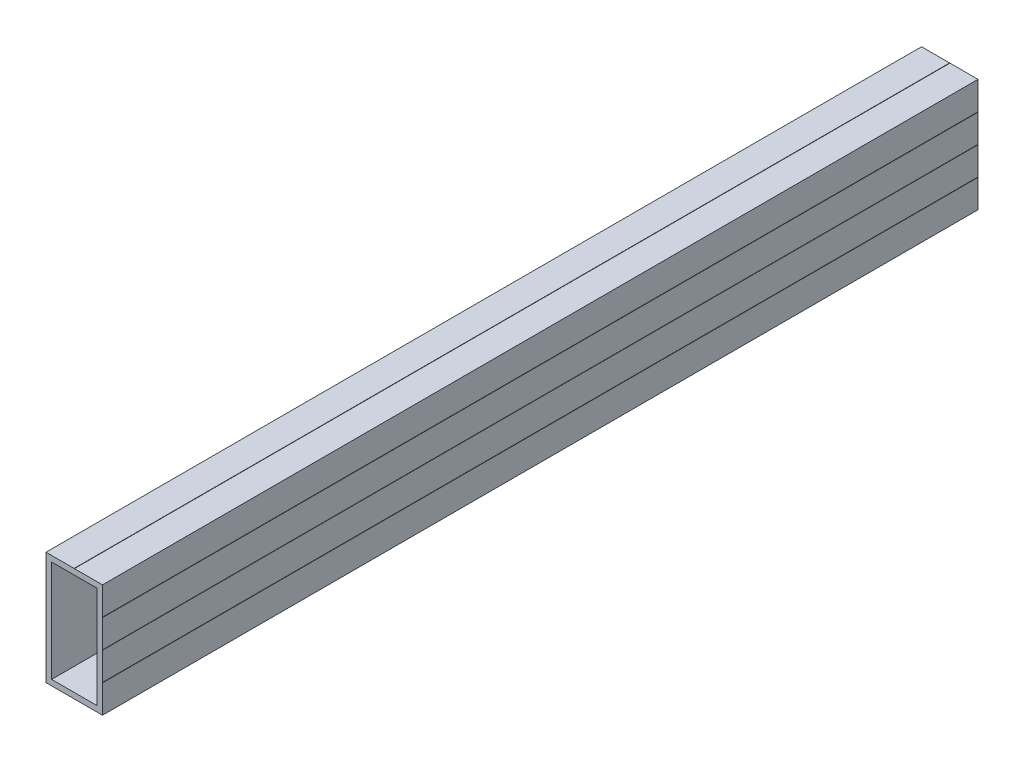
from build123d import *

# Parameters (mm, degrees)
SKETCH1_W           = 1498.6
SKETCH1_H           = 50.8
BOSS_EXTRUDE1_DEPTH = 25.4
CUT_EXTRUDE1_DEPTH  = 1498.6
CUT_EXTRUDE2_DEPTH  = 1499.869043646
CUT_EXTRUDE3_DEPTH  = 1498.6
CUT_EXTRUDE4_DEPTH  = 1498.6
CUT_EXTRUDE5_DEPTH  = 1499.869043646
CUT_EXTRUDE6_DEPTH  = 1499.869043646
CUT_EXTRUDE7_DEPTH  = 1498.6
CUT_EXTRUDE8_DEPTH  = 1498.6
SKETCH10_W          = 20.32
SKETCH10_H          = 45.72
CUT_EXTRUDE9_DEPTH  = 1499.869043646
DRAFT1_ANGLE        = 45
DRAFT2_ANGLE        = 45.000000005
DRAFT3_ANGLE        = 45
DRAFT4_ANGLE        = 45
DRAFT5_ANGLE        = 45
DRAFT6_ANGLE        = 44.999999995
SKETCH11_W          = 61.962293059
SKETCH11_H          = 88.678950317
CUT_EXTRUDE10_DEPTH = 1104.9


with BuildPart() as part:
    # Sketch1 → Boss-Extrude1 (new body)
    with BuildSketch(Plane(origin=(12.7, 0, 0), x_dir=(0, 0, -1), z_dir=(1, 0, 0))):
        Rectangle(SKETCH1_W, SKETCH1_H)
    extrude(amount=-BOSS_EXTRUDE1_DEPTH)

    # Sketch2 → Cut-Extrude1 (cut)
    with BuildSketch(Plane.XY.offset(749.3)):
        Polygon((0.0762, 25.4), (-0.0762, 25.4), (0.0762, 25.2476), align=None)
    extrude(amount=-CUT_EXTRUDE1_DEPTH, mode=Mode.SUBTRACT)

    # Sketch3 → Cut-Extrude2 (cut, through all)
    with BuildSketch(Plane.XY.offset(749.3)):
        Polygon((12.7, 12.6238), (12.7, 12.7762), (12.5476, 12.7762), align=None)
    extrude(amount=-CUT_EXTRUDE2_DEPTH, mode=Mode.SUBTRACT)

    # Sketch4 → Cut-Extrude3 (cut)
    with BuildSketch(Plane.XY.offset(749.3)):
        Polygon((12.7, -0.0762), (12.7, 0.0762), (12.5476, -0.0762), align=None)
    extrude(amount=-CUT_EXTRUDE3_DEPTH, mode=Mode.SUBTRACT)

    # Sketch5 → Cut-Extrude4 (cut)
    with BuildSketch(Plane.XY.offset(749.3)):
        Polygon((12.7, -12.7762), (12.7, -12.6238), (12.5476, -12.6238), align=None)
    extrude(amount=-CUT_EXTRUDE4_DEPTH, mode=Mode.SUBTRACT)

    # Sketch6 → Cut-Extrude5 (cut, through all)
    with BuildSketch(Plane.XY.offset(749.3)):
        Polygon((0.0762, -25.4), (-0.0762, -25.2476), (-0.0762, -25.4), align=None)
    extrude(amount=-CUT_EXTRUDE5_DEPTH, mode=Mode.SUBTRACT)

    # Sketch7 → Cut-Extrude6 (cut, through all)
    with BuildSketch(Plane.XY.offset(749.3)):
        Polygon((-12.7, -12.6238), (-12.7, -12.7762), (-12.5476, -12.7762), align=None)
    extrude(amount=-CUT_EXTRUDE6_DEPTH, mode=Mode.SUBTRACT)

    # Sketch8 → Cut-Extrude7 (cut)
    with BuildSketch(Plane.XY.offset(749.3)):
        Polygon((-12.7, 0.0762), (-12.7, -0.0762), (-12.5476, 0.0762), align=None)
    extrude(amount=-CUT_EXTRUDE7_DEPTH, mode=Mode.SUBTRACT)

    # Sketch9 → Cut-Extrude8 (cut)
    with BuildSketch(Plane.XY.offset(749.3)):
        Polygon((-12.7, 12.7762), (-12.7, 12.6238), (-12.5476, 12.6238), align=None)
    extrude(amount=-CUT_EXTRUDE8_DEPTH, mode=Mode.SUBTRACT)

    # Sketch10 → Cut-Extrude9 (cut, through all)
    with BuildSketch(Plane.XY.offset(749.3)):
        Rectangle(SKETCH10_W, SKETCH10_H)
    extrude(amount=-CUT_EXTRUDE9_DEPTH, mode=Mode.SUBTRACT)

    # Draft1
    draft1_faces = [part.faces().sort_by_distance(p)[0] for p in [
        (0.0762, 25.3238, 0),
    ]]
    draft(draft1_faces, Plane(origin=(-12.7, 25.4, -749.3), x_dir=(0, 0, 1), z_dir=(0, 1, 0)), DRAFT1_ANGLE)

    # Draft2
    draft2_faces = [part.faces().sort_by_distance(p)[0] for p in [
        (12.6238, 12.7762, 0),
    ]]
    draft(draft2_faces, Plane(origin=(12.7, 0, 0), x_dir=(0, 0, 1), z_dir=(1, 0, 0)), DRAFT2_ANGLE)

    # Draft3
    draft3_faces = [part.faces().sort_by_distance(p)[0] for p in [
        (-0.0762, -25.3238, 0),
    ]]
    draft(draft3_faces, Plane(origin=(-12.7, -25.4, 749.3), x_dir=(0, 0, -1), z_dir=(0, -1, 0)), DRAFT3_ANGLE)

    # Draft4
    draft4_faces = [part.faces().sort_by_distance(p)[0] for p in [
        (-12.6238, -12.7762, 0),
    ]]
    draft(draft4_faces, Plane(origin=(-12.7, 0, 0), x_dir=(0, 0, -1), z_dir=(-1, 0, 0)), DRAFT4_ANGLE)

    # Draft5
    draft5_faces = [part.faces().sort_by_distance(p)[0] for p in [
        (12.6238, -12.6238, 0),
        (12.6238, 0, 0),
    ]]
    draft(draft5_faces, Plane(origin=(12.7, 0, 0), x_dir=(0, 0, 1), z_dir=(1, 0, 0)), DRAFT5_ANGLE)

    # Draft6
    draft6_faces = [part.faces().sort_by_distance(p)[0] for p in [
        (-12.6238, 0, 0),
        (-12.6238, 12.6238, 0),
    ]]
    draft(draft6_faces, Plane(origin=(-12.7, 0, 0), x_dir=(0, 0, -1), z_dir=(-1, 0, 0)), DRAFT6_ANGLE)

    # Sketch11 → Cut-Extrude10 (cut)
    with BuildSketch(Plane(origin=(0, 0, -749.3), x_dir=(-1, 0, 0), z_dir=(0, 0, -1))):
        with Locations((-2.92473676, 0.325700182)):
            Rectangle(SKETCH11_W, SKETCH11_H)
    extrude(amount=-CUT_EXTRUDE10_DEPTH, mode=Mode.SUBTRACT)


solid = part.part
